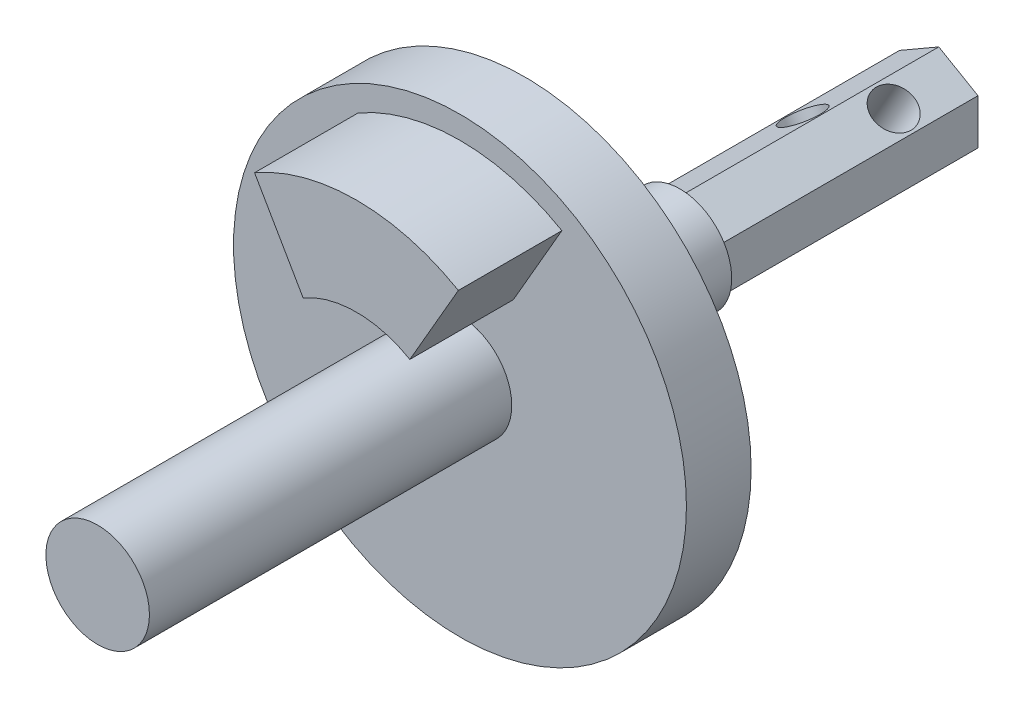
from build123d import *

# Parameters (mm, degrees)
SKETCH1_R           = 17.5
BOSS_EXTRUDE1_DEPTH = 2.5
BOSS_EXTRUDE2_DEPTH = 8
SKETCH3_R           = 4
BOSS_EXTRUDE3_DEPTH = 28
BOSS_EXTRUDE4_START = 12
SKETCH7_R           = 4
BOSS_EXTRUDE4_DEPTH = 12
BOSS_EXTRUDE5_DEPTH = 20
SKETCH10_R          = 1.55
CUT_EXTRUDE1_DEPTH  = 6.1
SKETCH11_R          = 1.55
CUT_EXTRUDE4_DEPTH  = 6.1


with BuildPart() as part:
    # Sketch1 → Boss-Extrude1 (new, symmetric)
    with BuildSketch(Plane.XY):
        Circle(SKETCH1_R)
    extrude(amount=BOSS_EXTRUDE1_DEPTH, both=True)

    # Sketch2 → Boss-Extrude2 (add)
    with BuildSketch(Plane.XY.offset(2.5)):
        with BuildLine():
            Line((7.875, 13.63990011), (4.125, 7.144709581))
            ThreePointArc((4.125, 7.144709581), (0, 8.25), (-4.125, 7.144709581))
            Line((-4.125, 7.144709581), (-7.875, 13.63990011))
            ThreePointArc((-7.875, 13.63990011), (0, 15.75), (7.875, 13.63990011))
        make_face()
    extrude(amount=BOSS_EXTRUDE2_DEPTH)

    # Sketch3 → Boss-Extrude3 (add)
    with BuildSketch(Plane.XY.offset(2.5)):
        Circle(SKETCH3_R)
    extrude(amount=BOSS_EXTRUDE3_DEPTH)

    # Sketch7 → Boss-Extrude4 (add)
    with BuildSketch(Plane(origin=(0, 0, -2.5), x_dir=(-1, 0, 0), z_dir=(0, 0, -1)).offset(BOSS_EXTRUDE4_START)):
        Circle(SKETCH7_R)
    extrude(amount=-BOSS_EXTRUDE4_DEPTH)

    # Sketch9 → Boss-Extrude5 (add)
    with BuildSketch(Plane(origin=(0, 0, -14.5), x_dir=(-1, 0, 0), z_dir=(0, 0, -1))):
        Polygon((0, 3.5), (-3.031088913, 1.75), (-3.031088913, -1.75), (0, -3.5), (3.031088913, -1.75), (3.031088913, 1.75), align=None)
    extrude(amount=BOSS_EXTRUDE5_DEPTH)

    # Sketch10 → Cut-Extrude1 (cut)
    with BuildSketch(Plane(origin=(-1.515544457, -2.625, 0), x_dir=(0.866025403784435, -0.5000000000000062, 0), z_dir=(-0.5000000000000062, -0.866025403784435, 0))):
        with Locations((0, -29.5)):
            Circle(SKETCH10_R)
    extrude(amount=-CUT_EXTRUDE1_DEPTH, mode=Mode.SUBTRACT)

    # Sketch11 → Cut-Extrude4 (cut)
    with BuildSketch(Plane(origin=(1.515544457, -2.625, 0), x_dir=(0, 0, 1), z_dir=(-0.49999999999999717, 0.8660254037844404, 0))):
        with Locations((-25.5, 0)):
            Circle(SKETCH11_R)
    extrude(amount=CUT_EXTRUDE4_DEPTH, mode=Mode.SUBTRACT)


solid = part.part
